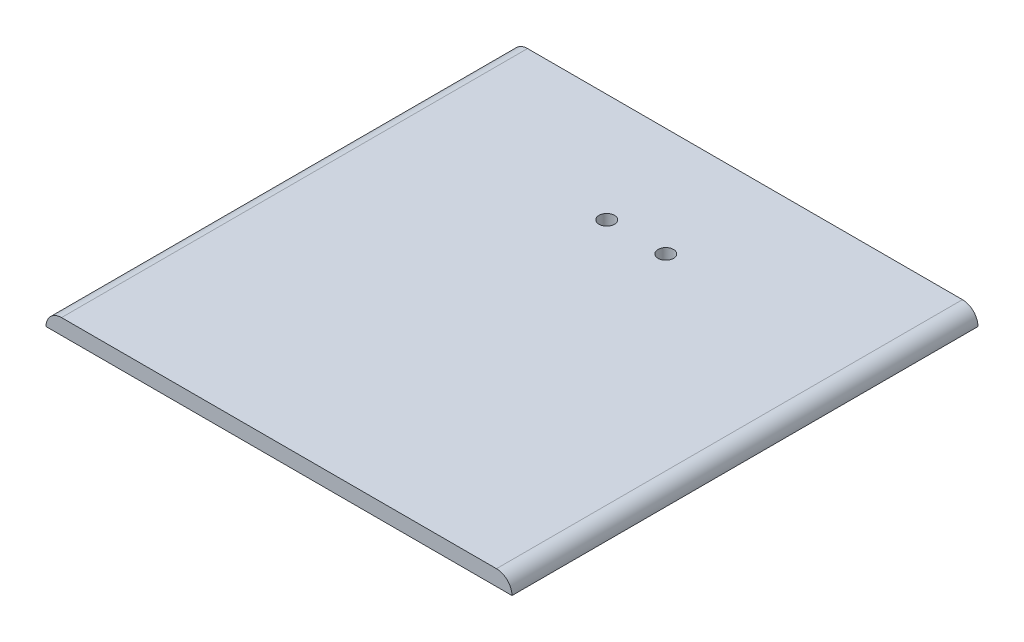
from build123d import *

# Parameters (mm, degrees)
SKETCH1_W           = 300
SKETCH1_H           = 300
BOSS_EXTRUDE1_DEPTH = 10
SKETCH2_R           = 5
CUT_EXTRUDE1_DEPTH  = 10
FILLET2_R           = 10
FILLET3_R           = 10


with BuildPart() as part:
    # Sketch1 → Boss-Extrude1 (new body)
    with BuildSketch(Plane(origin=(0, 0, 0), x_dir=(1, 0, 0), z_dir=(0, 1, 0))):
        Rectangle(SKETCH1_W, SKETCH1_H)
    extrude(amount=BOSS_EXTRUDE1_DEPTH)

    # Sketch2 → Cut-Extrude1 (cut)
    with BuildSketch(Plane(origin=(0, 10, 0), x_dir=(1, 0, 0), z_dir=(0, 1, 0))):
        with Locations(Location((-19, 80, 0), (0, 0, 270))):
            Circle(SKETCH2_R)
        with Locations(Location((19, 80, 0), (0, 0, 270))):
            Circle(SKETCH2_R)
    extrude(amount=-CUT_EXTRUDE1_DEPTH, mode=Mode.SUBTRACT)

    # Fillet2
    fillet2_edges = [part.edges().sort_by_distance(p)[0] for p in [
        (-150, 10, 0),
    ]]
    fillet(fillet2_edges, radius=FILLET2_R - 0.0001)  # a hair under: the kernel refuses the full size

    # Fillet3
    fillet3_edges = [part.edges().sort_by_distance(p)[0] for p in [
        (150, 10, 0),
    ]]
    fillet(fillet3_edges, radius=FILLET3_R - 0.0001)  # a hair under: the kernel refuses the full size


solid = part.part
